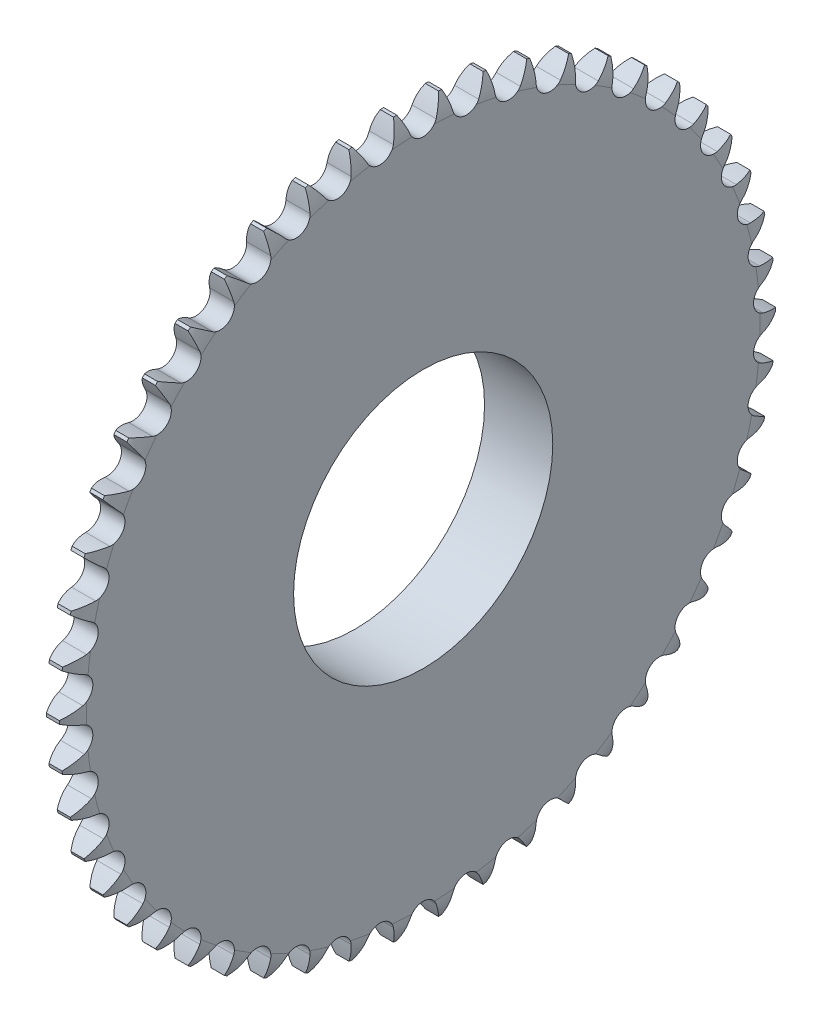
from build123d import *

# Parameters (mm, degrees)
TOOTHCUT_DEPTH     = 186.836250828
TEETHCUTS_COUNT    = 50
TEETHCUTS_ANGLE    = 352.8
HUBNEAONESKE_R     = 60
HUBNEARONE_DEPTH   = 16.0705
HUBNEARONEFILLET_R = 0.6
BORSKE_R           = 47.5
BORE_DEPTH         = 25.0005


with BuildPart() as part:
    # BasProSke → Base-Revolve (revolve)
    with BuildSketch(Plane(origin=(0, 0, 0), x_dir=(1, 0, 0), z_dir=(0, 1, 0))):
        with BuildLine():
            Line((0, 0), (0, 123.427074752))
            ThreePointArc((0, 123.427074752), (0.524605563, 127.47442149), (2.06375, 131.254270829))
            Line((2.06375, 131.254270829), (6.86625, 131.254270829))
            ThreePointArc((6.86625, 131.254270829), (8.405394437, 127.47442149), (8.93, 123.427074752))
            Line((8.93, 123.427074752), (8.93, 0))
            Line((8.93, 0), (0, 0))
        make_face()
    revolve(axis=Axis((-10, 0, 0), (1, 0, 0)))

    # TooCutSke → ToothCut (cut, through all)
    with BuildSketch(Plane(origin=(0, 0, 0), x_dir=(0, 0, -1), z_dir=(1, 0, 0))):
        with BuildLine():
            ThreePointArc((4.793216317, 124.632844502), (6.245871471, 128.121287584), (7.903779946, 131.516988044))
            ThreePointArc((7.903779946, 131.516988044), (0, 131.754270829), (-7.903779946, 131.516988044))
            ThreePointArc((-7.903779946, 131.516988044), (-6.245871471, 128.121287584), (-4.793216317, 124.632844502))
            ThreePointArc((-4.793216317, 124.632844502), (0, 121.332395829), (4.793216317, 124.632844502))
        make_face()
    toothcut = extrude(amount=TOOTHCUT_DEPTH, mode=Mode.SUBTRACT)

    # TeethCuts: ToothCut ×50 about axis
    teethcuts_axis = Axis((-10, 0, 0), (1, 0, 0))
    for i in range(1, TEETHCUTS_COUNT):
        add(toothcut.rotate(teethcuts_axis, i * TEETHCUTS_ANGLE / (TEETHCUTS_COUNT - 1)), mode=Mode.SUBTRACT)

    # HubNeaOneSke → HubNearOne (add)
    with BuildSketch(Plane.ZY):
        Circle(HUBNEAONESKE_R)
    extrude(amount=HUBNEARONE_DEPTH)

    # HubNearOneFillet
    hubnearonefillet_edges = [part.edges().sort_by_distance(p)[0] for p in [
        (0, 0, -60),
    ]]
    fillet(hubnearonefillet_edges, radius=HUBNEARONEFILLET_R)

    # BorSke → Bore (cut, symmetric)
    with BuildSketch(Plane(origin=(0, 0, 0), x_dir=(0, 0, -1), z_dir=(1, 0, 0))):
        Circle(BORSKE_R)
    extrude(amount=BORE_DEPTH, both=True, mode=Mode.SUBTRACT)


solid = part.part
